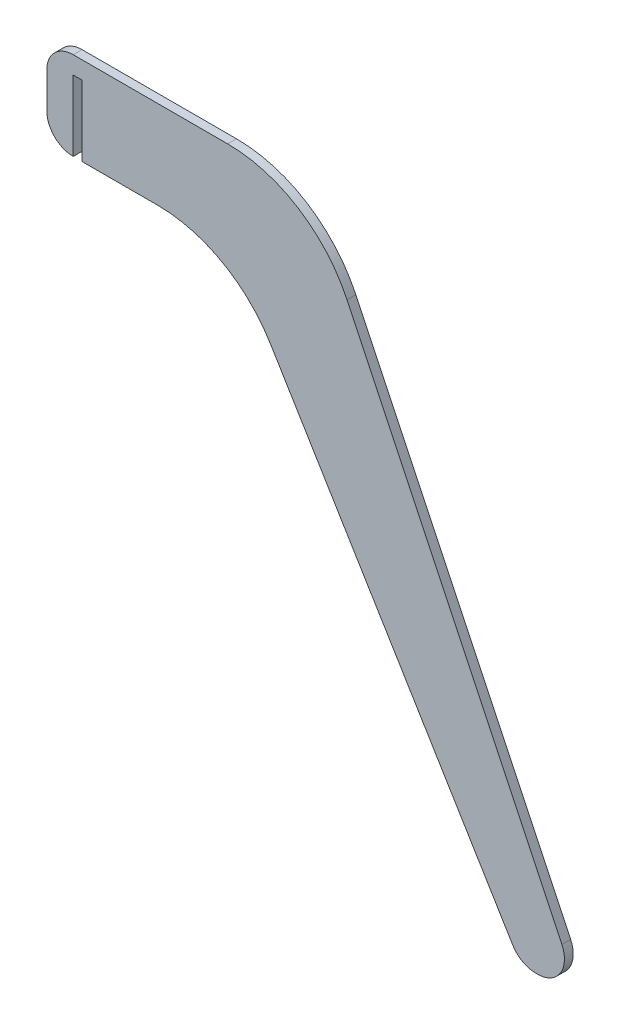
from build123d import *

# Parameters (mm, degrees)
BOSS_EXTRUDE1_DEPTH = 0.1
FILLET1_R           = 1.5
FILLET2_R           = 0.3


with BuildPart() as part:
    # Sketch2 → Boss-Extrude1 (new body)
    with BuildSketch(Plane.XY):
        Polygon((0, 0), (0, 1), (3, 1), (6.049495139, -5.400912487), (5.375421316, -5.400912487), (2.1, 0), (0.4, 0), (0.4, 0.8), (0.3, 0.8), (0.3, 0), align=None)
    extrude(amount=BOSS_EXTRUDE1_DEPTH)

    # Fillet1
    fillet1_edges = [part.edges().sort_by_distance(p)[0] for p in [
        (3, 1, 0.05),
        (2.1, 0, 0.05),
    ]]
    fillet(fillet1_edges, radius=FILLET1_R)

    # Fillet2
    fillet2_edges = [part.edges().sort_by_distance(p)[0] for p in [
        (6.049495139, -5.400912487, 0.05),
        (5.375421316, -5.400912487, 0.05),
        (0, 1, 0.05),
        (0, 0, 0.05),
    ]]
    fillet(fillet2_edges, radius=FILLET2_R - 0.0001)  # a hair under: the kernel refuses the full size


solid = part.part
